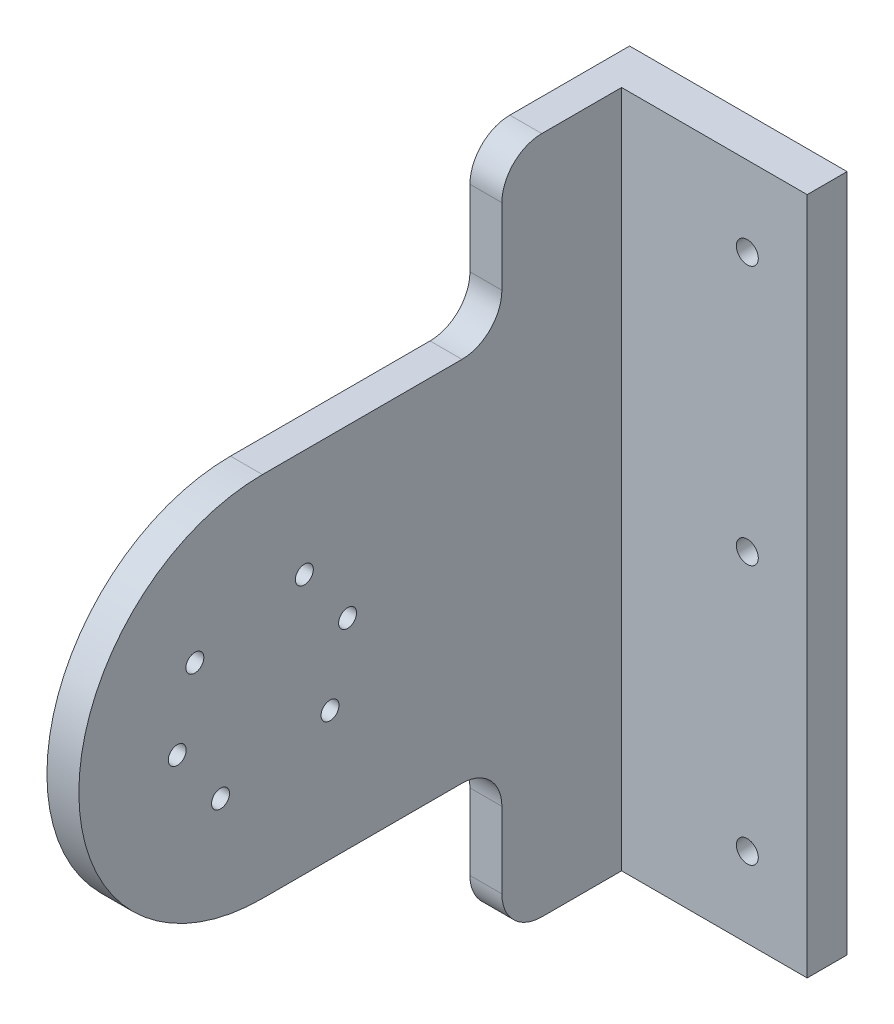
from build123d import *

# Parameters (mm, degrees)
EXTRUDE_1_DEPTH     = 170
CUT_EXTRUDE_1_DEPTH = 180
SKETCH_5_W          = 10
SKETCH_5_H          = 170
EXTRUDE_3_DEPTH     = 56.5
SKETCH_6_R          = 2.75
CUT_EXTRUDE_3_DEPTH = 52
FILLET_2_R          = 10
MOVE_FACE_2_BY      = 10
SKETCH_9_R          = 2.25
CUT_EXTRUDE_5_DEPTH = 10


with BuildPart() as part:
    # 草图1 → 凸台-拉伸1 (new body)
    with BuildSketch(Plane(origin=(0, 0, 0), x_dir=(1, 0, 0), z_dir=(0, 1, 0))):
        Polygon((8, -10), (8, -300), (0, -300), (0, 0), (8, 0), align=None)
    extrude(amount=EXTRUDE_1_DEPTH)

    # 草图2 → 切除-拉伸1 (cut)
    with BuildSketch(Plane(origin=(8, 0, 0), x_dir=(0, 0, -1), z_dir=(1, 0, 0))):
        with BuildLine():
            Line((-100, 131), (-40, 131))
            Line((-40, 131), (-40, 170))
            Line((-40, 170), (-300, 170))
            Line((-300, 170), (-300, 0))
            Line((-300, 0), (-40, 0))
            Line((-40, 0), (-40, 39))
            Line((-40, 39), (-100, 39))
            ThreePointArc((-100, 39), (-146, 85), (-100, 131))
        make_face()
    extrude(amount=-CUT_EXTRUDE_1_DEPTH, mode=Mode.SUBTRACT)

    # 草图5 → 凸台-拉伸3 (add)
    with BuildSketch(Plane(origin=(8, 0, 0), x_dir=(0, 0, -1), z_dir=(1, 0, 0))):
        with Locations((-5, 85)):
            Rectangle(SKETCH_5_W, SKETCH_5_H)
    extrude(amount=EXTRUDE_3_DEPTH)

    # 草图6 → 切除-拉伸3 (cut)
    with BuildSketch(Plane(origin=(0, 0, 0), x_dir=(-1, 0, 0), z_dir=(0, 0, -1))):
        with Locations((-39.5, 150)):
            Circle(SKETCH_6_R)
        with Locations((-39.5, 20)):
            Circle(SKETCH_6_R)
        with Locations((-39.5, 85)):
            Circle(SKETCH_6_R)
    extrude(amount=-CUT_EXTRUDE_3_DEPTH, mode=Mode.SUBTRACT)

    # 圆角2
    fillet_2_edges = [part.edges().sort_by_distance(p)[0] for p in [
        (4, 170, 40),
        (4, 131, 40),
        (4, 0, 40),
        (4, 39, 40),
    ]]
    fillet(fillet_2_edges, radius=FILLET_2_R)

    # Move Face 2: a face moved inward by 10.0
    extrude(part.faces().sort_by_distance((64.5, 85, 5))[0], amount=MOVE_FACE_2_BY, dir=(-1, 0, 0), mode=Mode.SUBTRACT)

    # 草图9 → 切除-拉伸5 (cut)
    with BuildSketch(Plane.ZY):
        with Locations((121.340186917, 80.797747944)):
            Circle(SKETCH_9_R)
        with Locations((116.936319575, 98.646376049)):
            Circle(SKETCH_9_R)
        with Locations((78.659813083, 89.202252056)):
            Circle(SKETCH_9_R)
        with Locations((89.501904097, 104.048687157)):
            Circle(SKETCH_9_R)
        with Locations((83.063680425, 71.353623951)):
            Circle(SKETCH_9_R)
        with Locations((110.498095903, 65.951312843)):
            Circle(SKETCH_9_R)
    extrude(amount=-CUT_EXTRUDE_5_DEPTH, mode=Mode.SUBTRACT)


solid = part.part
